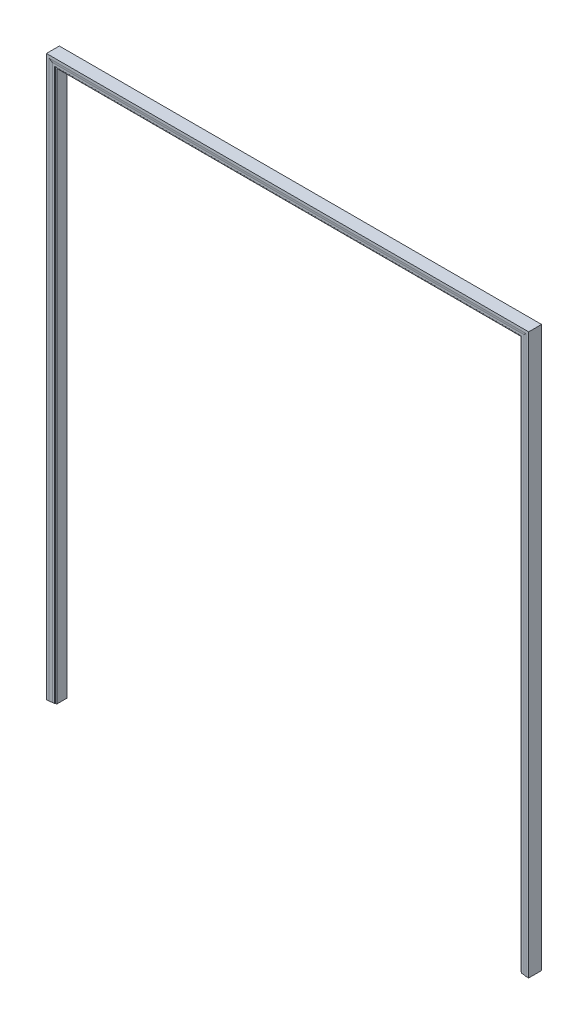
from build123d import *

# Parameters (mm, degrees)
SKETCH1_W           = 1870
SKETCH1_H           = 2205
SKETCH1_W_2         = 1800
SKETCH1_H_2         = 2135
BOSS_EXTRUDE1_DEPTH = 25
SKETCH2_W           = 1810
SKETCH2_H           = 2145
CUT_EXTRUDE2_DEPTH  = 5
SKETCH3_W           = 1825
SKETCH3_H           = 2160
CUT_EXTRUDE4_DEPTH  = 2
FILLET1_R           = 1
CHAMFER1_SIZE       = 2.33256371
CHAMFER1_SIZE_2     = 12
FILLET2_R           = 1
CHAMFER2_SIZE       = 2.33256371
CHAMFER2_SIZE_2     = 12
SKETCH5_W           = 1870
SKETCH5_H           = 50
CUT_EXTRUDE5_DEPTH  = 35


with BuildPart() as part:
    # Sketch1 → Boss-Extrude1 (new, symmetric)
    with BuildSketch(Plane.XY):
        Rectangle(SKETCH1_W, SKETCH1_H)
        Rectangle(SKETCH1_W_2, SKETCH1_H_2, mode=Mode.SUBTRACT)
    extrude(amount=BOSS_EXTRUDE1_DEPTH, both=True)

    # Sketch2 → Cut-Extrude2 (cut)
    with BuildSketch(Plane.XY.offset(25)):
        Rectangle(SKETCH2_W, SKETCH2_H)
    cut_extrude2 = extrude(amount=-CUT_EXTRUDE2_DEPTH, mode=Mode.SUBTRACT)

    # Sketch3 → Cut-Extrude4 (cut)
    with BuildSketch(Plane.XY.offset(25)):
        Rectangle(SKETCH3_W, SKETCH3_H)
    cut_extrude4 = extrude(amount=-CUT_EXTRUDE4_DEPTH, mode=Mode.SUBTRACT)

    # Fillet1
    fillet1_edges = [part.edges().sort_by_distance(p)[0] for p in [
        (0, -1072.5, 23),
        (-905, 0, 23),
        (0, 1072.5, 23),
        (905, 0, 23),
    ]]
    fillet(fillet1_edges, radius=FILLET1_R)

    # Chamfer1
    # the kernel refuses this chamfer: 12, 2.33256371 mm, written as the material it takes off along each edge
    with BuildSketch(Plane(origin=(912.5, 1080, 25), x_dir=(0, -0.1907987049962236, -0.9816291836389973), z_dir=(-1, 0, 0))) as chamfer1_piece_1_section:
        Polygon((CHAMFER1_SIZE * 0.981629183493, -CHAMFER1_SIZE * 0.190798704968), (-CHAMFER1_SIZE_2 * 0.190798704996, -CHAMFER1_SIZE_2 * 0.981629183639), (0, 0), align=None)
    chamfer1_piece_1 = extrude(amount=1825, mode=Mode.PRIVATE)
    chamfer1_piece_1 = split(chamfer1_piece_1, bisect_by=Plane(origin=(0, 1084.39239505, 23), z_dir=(0, 0, 1)), keep=Keep.TOP, mode=Mode.PRIVATE)
    add(chamfer1_piece_1, mode=Mode.SUBTRACT)
    with BuildSketch(Plane(origin=(912.5, -1080, 25), x_dir=(-0.1907987049962236, 0, -0.9816291836389973), z_dir=(0, 1, 0))) as chamfer1_piece_2_section:
        Polygon((CHAMFER1_SIZE * 0.981629183493, -CHAMFER1_SIZE * 0.190798704968), (-CHAMFER1_SIZE_2 * 0.190798704996, -CHAMFER1_SIZE_2 * 0.981629183639), (0, 0), align=None)
    chamfer1_piece_2 = extrude(amount=2160, mode=Mode.PRIVATE)
    chamfer1_piece_2 = split(chamfer1_piece_2, bisect_by=Plane(origin=(916.89239505, 0, 23), z_dir=(0, 0, 1)), keep=Keep.TOP, mode=Mode.PRIVATE)
    add(chamfer1_piece_2, mode=Mode.SUBTRACT)
    with BuildSketch(Plane(origin=(-912.5, -1080, 25), x_dir=(0, 0.1907987049962236, -0.9816291836389973), z_dir=(1, 0, 0))) as chamfer1_piece_3_section:
        Polygon((CHAMFER1_SIZE * 0.981629183493, -CHAMFER1_SIZE * 0.190798704968), (-CHAMFER1_SIZE_2 * 0.190798704996, -CHAMFER1_SIZE_2 * 0.981629183639), (0, 0), align=None)
    chamfer1_piece_3 = extrude(amount=1825, mode=Mode.PRIVATE)
    chamfer1_piece_3 = split(chamfer1_piece_3, bisect_by=Plane(origin=(0, -1084.39239505, 23), z_dir=(0, 0, 1)), keep=Keep.TOP, mode=Mode.PRIVATE)
    add(chamfer1_piece_3, mode=Mode.SUBTRACT)
    with BuildSketch(Plane(origin=(-912.5, 1080, 25), x_dir=(0.1907987049962236, 0, -0.9816291836389973), z_dir=(0, -1, 0))) as chamfer1_piece_4_section:
        Polygon((CHAMFER1_SIZE * 0.981629183493, -CHAMFER1_SIZE * 0.190798704968), (-CHAMFER1_SIZE_2 * 0.190798704996, -CHAMFER1_SIZE_2 * 0.981629183639), (0, 0), align=None)
    chamfer1_piece_4 = extrude(amount=2160, mode=Mode.PRIVATE)
    chamfer1_piece_4 = split(chamfer1_piece_4, bisect_by=Plane(origin=(-916.89239505, 0, 23), z_dir=(0, 0, 1)), keep=Keep.TOP, mode=Mode.PRIVATE)
    add(chamfer1_piece_4, mode=Mode.SUBTRACT)
    with BuildSketch(Plane(origin=(912.5, -1080, 25), x_dir=(-0.1907987049962236, 0, -0.9816291836389973), z_dir=(0, 1, 0))) as chamfer1_piece_5a_section:
        Polygon((CHAMFER1_SIZE * 0.981629183493, -CHAMFER1_SIZE * 0.190798704968), (-CHAMFER1_SIZE_2 * 0.190798704996, -CHAMFER1_SIZE_2 * 0.981629183639), (0, 0), align=None)
    chamfer1_piece_5a = extrude(amount=2191.178793389, mode=Mode.PRIVATE)
    chamfer1_piece_5a = split(chamfer1_piece_5a, bisect_by=Plane(origin=(916.89239505, 1095.589396695, 23), z_dir=(0, 0, 1)), keep=Keep.TOP, mode=Mode.PRIVATE)
    chamfer1_piece_5a = split(chamfer1_piece_5a, bisect_by=Plane(origin=(916.89239505, 1080, 24.399204817), z_dir=(0, 1, 0)), keep=Keep.TOP, mode=Mode.PRIVATE)
    with BuildSketch(Plane(origin=(943.678793389, 1080, 25), x_dir=(0, -0.1907987049962236, -0.9816291836389973), z_dir=(-1, 0, 0))) as chamfer1_piece_5b_section:
        Polygon((CHAMFER1_SIZE * 0.981629183493, -CHAMFER1_SIZE * 0.190798704968), (-CHAMFER1_SIZE_2 * 0.190798704996, -CHAMFER1_SIZE_2 * 0.981629183639), (0, 0), align=None)
    chamfer1_piece_5b = extrude(amount=1856.178793389, mode=Mode.PRIVATE)
    chamfer1_piece_5b = split(chamfer1_piece_5b, bisect_by=Plane(origin=(928.089396695, 1084.39239505, 23), z_dir=(0, 0, 1)), keep=Keep.TOP, mode=Mode.PRIVATE)
    chamfer1_piece_5b = split(chamfer1_piece_5b, bisect_by=Plane(origin=(912.5, 1084.39239505, 24.399204817), z_dir=(1, 0, 0)), keep=Keep.TOP, mode=Mode.PRIVATE)
    chamfer1_piece_5 = chamfer1_piece_5a & chamfer1_piece_5b
    add(chamfer1_piece_5, mode=Mode.SUBTRACT)
    with BuildSketch(Plane(origin=(912.5, 1080, 25), x_dir=(0, -0.1907987049962236, -0.9816291836389973), z_dir=(-1, 0, 0))) as chamfer1_piece_6a_section:
        Polygon((CHAMFER1_SIZE * 0.981629183493, -CHAMFER1_SIZE * 0.190798704968), (-CHAMFER1_SIZE_2 * 0.190798704996, -CHAMFER1_SIZE_2 * 0.981629183639), (0, 0), align=None)
    chamfer1_piece_6a = extrude(amount=1856.178793389, mode=Mode.PRIVATE)
    chamfer1_piece_6a = split(chamfer1_piece_6a, bisect_by=Plane(origin=(-928.089396695, 1084.39239505, 23), z_dir=(0, 0, 1)), keep=Keep.TOP, mode=Mode.PRIVATE)
    chamfer1_piece_6a = split(chamfer1_piece_6a, bisect_by=Plane(origin=(-912.5, 1084.39239505, 24.399204817), z_dir=(-1, 0, 0)), keep=Keep.TOP, mode=Mode.PRIVATE)
    with BuildSketch(Plane(origin=(-912.5, 1111.178793389, 25), x_dir=(0.1907987049962236, 0, -0.9816291836389973), z_dir=(0, -1, 0))) as chamfer1_piece_6b_section:
        Polygon((CHAMFER1_SIZE * 0.981629183493, -CHAMFER1_SIZE * 0.190798704968), (-CHAMFER1_SIZE_2 * 0.190798704996, -CHAMFER1_SIZE_2 * 0.981629183639), (0, 0), align=None)
    chamfer1_piece_6b = extrude(amount=2191.178793389, mode=Mode.PRIVATE)
    chamfer1_piece_6b = split(chamfer1_piece_6b, bisect_by=Plane(origin=(-916.89239505, 1095.589396695, 23), z_dir=(0, 0, 1)), keep=Keep.TOP, mode=Mode.PRIVATE)
    chamfer1_piece_6b = split(chamfer1_piece_6b, bisect_by=Plane(origin=(-916.89239505, 1080, 24.399204817), z_dir=(0, 1, 0)), keep=Keep.TOP, mode=Mode.PRIVATE)
    chamfer1_piece_6 = chamfer1_piece_6a & chamfer1_piece_6b
    add(chamfer1_piece_6, mode=Mode.SUBTRACT)
    with BuildSketch(Plane(origin=(912.5, -1111.178793389, 25), x_dir=(-0.1907987049962236, 0, -0.9816291836389973), z_dir=(0, 1, 0))) as chamfer1_piece_7a_section:
        Polygon((CHAMFER1_SIZE * 0.981629183493, -CHAMFER1_SIZE * 0.190798704968), (-CHAMFER1_SIZE_2 * 0.190798704996, -CHAMFER1_SIZE_2 * 0.981629183639), (0, 0), align=None)
    chamfer1_piece_7a = extrude(amount=2191.178793389, mode=Mode.PRIVATE)
    chamfer1_piece_7a = split(chamfer1_piece_7a, bisect_by=Plane(origin=(916.89239505, -1095.589396695, 23), z_dir=(0, 0, 1)), keep=Keep.TOP, mode=Mode.PRIVATE)
    chamfer1_piece_7a = split(chamfer1_piece_7a, bisect_by=Plane(origin=(916.89239505, -1080, 24.399204817), z_dir=(0, -1, 0)), keep=Keep.TOP, mode=Mode.PRIVATE)
    with BuildSketch(Plane(origin=(-912.5, -1080, 25), x_dir=(0, 0.1907987049962236, -0.9816291836389973), z_dir=(1, 0, 0))) as chamfer1_piece_7b_section:
        Polygon((CHAMFER1_SIZE * 0.981629183493, -CHAMFER1_SIZE * 0.190798704968), (-CHAMFER1_SIZE_2 * 0.190798704996, -CHAMFER1_SIZE_2 * 0.981629183639), (0, 0), align=None)
    chamfer1_piece_7b = extrude(amount=1856.178793389, mode=Mode.PRIVATE)
    chamfer1_piece_7b = split(chamfer1_piece_7b, bisect_by=Plane(origin=(928.089396695, -1084.39239505, 23), z_dir=(0, 0, 1)), keep=Keep.TOP, mode=Mode.PRIVATE)
    chamfer1_piece_7b = split(chamfer1_piece_7b, bisect_by=Plane(origin=(912.5, -1084.39239505, 24.399204817), z_dir=(1, 0, 0)), keep=Keep.TOP, mode=Mode.PRIVATE)
    chamfer1_piece_7 = chamfer1_piece_7a & chamfer1_piece_7b
    add(chamfer1_piece_7, mode=Mode.SUBTRACT)
    with BuildSketch(Plane(origin=(-943.678793389, -1080, 25), x_dir=(0, 0.1907987049962236, -0.9816291836389973), z_dir=(1, 0, 0))) as chamfer1_piece_8a_section:
        Polygon((CHAMFER1_SIZE * 0.981629183493, -CHAMFER1_SIZE * 0.190798704968), (-CHAMFER1_SIZE_2 * 0.190798704996, -CHAMFER1_SIZE_2 * 0.981629183639), (0, 0), align=None)
    chamfer1_piece_8a = extrude(amount=1856.178793389, mode=Mode.PRIVATE)
    chamfer1_piece_8a = split(chamfer1_piece_8a, bisect_by=Plane(origin=(-928.089396695, -1084.39239505, 23), z_dir=(0, 0, 1)), keep=Keep.TOP, mode=Mode.PRIVATE)
    chamfer1_piece_8a = split(chamfer1_piece_8a, bisect_by=Plane(origin=(-912.5, -1084.39239505, 24.399204817), z_dir=(-1, 0, 0)), keep=Keep.TOP, mode=Mode.PRIVATE)
    with BuildSketch(Plane(origin=(-912.5, 1080, 25), x_dir=(0.1907987049962236, 0, -0.9816291836389973), z_dir=(0, -1, 0))) as chamfer1_piece_8b_section:
        Polygon((CHAMFER1_SIZE * 0.981629183493, -CHAMFER1_SIZE * 0.190798704968), (-CHAMFER1_SIZE_2 * 0.190798704996, -CHAMFER1_SIZE_2 * 0.981629183639), (0, 0), align=None)
    chamfer1_piece_8b = extrude(amount=2191.178793389, mode=Mode.PRIVATE)
    chamfer1_piece_8b = split(chamfer1_piece_8b, bisect_by=Plane(origin=(-916.89239505, -1095.589396695, 23), z_dir=(0, 0, 1)), keep=Keep.TOP, mode=Mode.PRIVATE)
    chamfer1_piece_8b = split(chamfer1_piece_8b, bisect_by=Plane(origin=(-916.89239505, -1080, 24.399204817), z_dir=(0, -1, 0)), keep=Keep.TOP, mode=Mode.PRIVATE)
    chamfer1_piece_8 = chamfer1_piece_8a & chamfer1_piece_8b
    add(chamfer1_piece_8, mode=Mode.SUBTRACT)

    # Mirror1: Cut-Extrude2, Cut-Extrude4 across plane
    add(cut_extrude2.mirror(Plane.XY), mode=Mode.SUBTRACT)
    add(cut_extrude4.mirror(Plane.XY), mode=Mode.SUBTRACT)

    # Fillet2
    fillet2_edges = [part.edges().sort_by_distance(p)[0] for p in [
        (0, 1072.5, -23),
        (0, -1072.5, -23),
        (-905, 0, -23),
        (905, 0, -23),
    ]]
    fillet(fillet2_edges, radius=FILLET2_R)

    # Chamfer2
    # the kernel refuses this chamfer: 12, 2.33256371 mm, written as the material it takes off along each edge
    with BuildSketch(Plane(origin=(912.5, 1080, -25), x_dir=(0, -0.1907987049962236, 0.9816291836389973), z_dir=(-1, 0, 0))) as chamfer2_piece_1_section:
        Polygon((CHAMFER2_SIZE * 0.981629183493, CHAMFER2_SIZE * 0.190798704968), (-CHAMFER2_SIZE_2 * 0.190798704996, CHAMFER2_SIZE_2 * 0.981629183639), (0, 0), align=None)
    chamfer2_piece_1 = extrude(amount=1825, mode=Mode.PRIVATE)
    chamfer2_piece_1 = split(chamfer2_piece_1, bisect_by=Plane(origin=(0, 1084.39239505, -23), z_dir=(0, 0, -1)), keep=Keep.TOP, mode=Mode.PRIVATE)
    add(chamfer2_piece_1, mode=Mode.SUBTRACT)
    with BuildSketch(Plane(origin=(912.5, -1080, -25), x_dir=(-0.1907987049962236, 0, 0.9816291836389973), z_dir=(0, 1, 0))) as chamfer2_piece_2_section:
        Polygon((CHAMFER2_SIZE * 0.981629183493, CHAMFER2_SIZE * 0.190798704968), (-CHAMFER2_SIZE_2 * 0.190798704996, CHAMFER2_SIZE_2 * 0.981629183639), (0, 0), align=None)
    chamfer2_piece_2 = extrude(amount=2160, mode=Mode.PRIVATE)
    chamfer2_piece_2 = split(chamfer2_piece_2, bisect_by=Plane(origin=(916.89239505, 0, -23), z_dir=(0, 0, -1)), keep=Keep.TOP, mode=Mode.PRIVATE)
    add(chamfer2_piece_2, mode=Mode.SUBTRACT)
    with BuildSketch(Plane(origin=(-912.5, 1080, -25), x_dir=(0.1907987049962236, 0, 0.9816291836389973), z_dir=(0, -1, 0))) as chamfer2_piece_3_section:
        Polygon((CHAMFER2_SIZE * 0.981629183493, CHAMFER2_SIZE * 0.190798704968), (-CHAMFER2_SIZE_2 * 0.190798704996, CHAMFER2_SIZE_2 * 0.981629183639), (0, 0), align=None)
    chamfer2_piece_3 = extrude(amount=2160, mode=Mode.PRIVATE)
    chamfer2_piece_3 = split(chamfer2_piece_3, bisect_by=Plane(origin=(-916.89239505, 0, -23), z_dir=(0, 0, -1)), keep=Keep.TOP, mode=Mode.PRIVATE)
    add(chamfer2_piece_3, mode=Mode.SUBTRACT)
    with BuildSketch(Plane(origin=(-912.5, -1080, -25), x_dir=(0, 0.1907987049962236, 0.9816291836389973), z_dir=(1, 0, 0))) as chamfer2_piece_4_section:
        Polygon((CHAMFER2_SIZE * 0.981629183493, CHAMFER2_SIZE * 0.190798704968), (-CHAMFER2_SIZE_2 * 0.190798704996, CHAMFER2_SIZE_2 * 0.981629183639), (0, 0), align=None)
    chamfer2_piece_4 = extrude(amount=1825, mode=Mode.PRIVATE)
    chamfer2_piece_4 = split(chamfer2_piece_4, bisect_by=Plane(origin=(0, -1084.39239505, -23), z_dir=(0, 0, -1)), keep=Keep.TOP, mode=Mode.PRIVATE)
    add(chamfer2_piece_4, mode=Mode.SUBTRACT)
    with BuildSketch(Plane(origin=(912.5, -1080, -25), x_dir=(-0.1907987049962236, 0, 0.9816291836389973), z_dir=(0, 1, 0))) as chamfer2_piece_5a_section:
        Polygon((CHAMFER2_SIZE * 0.981629183493, CHAMFER2_SIZE * 0.190798704968), (-CHAMFER2_SIZE_2 * 0.190798704996, CHAMFER2_SIZE_2 * 0.981629183639), (0, 0), align=None)
    chamfer2_piece_5a = extrude(amount=2191.178793389, mode=Mode.PRIVATE)
    chamfer2_piece_5a = split(chamfer2_piece_5a, bisect_by=Plane(origin=(916.89239505, 1095.589396695, -23), z_dir=(0, 0, -1)), keep=Keep.TOP, mode=Mode.PRIVATE)
    chamfer2_piece_5a = split(chamfer2_piece_5a, bisect_by=Plane(origin=(916.89239505, 1080, -24.399204817), z_dir=(0, 1, 0)), keep=Keep.TOP, mode=Mode.PRIVATE)
    with BuildSketch(Plane(origin=(943.678793389, 1080, -25), x_dir=(0, -0.1907987049962236, 0.9816291836389973), z_dir=(-1, 0, 0))) as chamfer2_piece_5b_section:
        Polygon((CHAMFER2_SIZE * 0.981629183493, CHAMFER2_SIZE * 0.190798704968), (-CHAMFER2_SIZE_2 * 0.190798704996, CHAMFER2_SIZE_2 * 0.981629183639), (0, 0), align=None)
    chamfer2_piece_5b = extrude(amount=1856.178793389, mode=Mode.PRIVATE)
    chamfer2_piece_5b = split(chamfer2_piece_5b, bisect_by=Plane(origin=(928.089396695, 1084.39239505, -23), z_dir=(0, 0, -1)), keep=Keep.TOP, mode=Mode.PRIVATE)
    chamfer2_piece_5b = split(chamfer2_piece_5b, bisect_by=Plane(origin=(912.5, 1084.39239505, -24.399204817), z_dir=(1, 0, 0)), keep=Keep.TOP, mode=Mode.PRIVATE)
    chamfer2_piece_5 = chamfer2_piece_5a & chamfer2_piece_5b
    add(chamfer2_piece_5, mode=Mode.SUBTRACT)
    with BuildSketch(Plane(origin=(912.5, 1080, -25), x_dir=(0, -0.1907987049962236, 0.9816291836389973), z_dir=(-1, 0, 0))) as chamfer2_piece_6a_section:
        Polygon((CHAMFER2_SIZE * 0.981629183493, CHAMFER2_SIZE * 0.190798704968), (-CHAMFER2_SIZE_2 * 0.190798704996, CHAMFER2_SIZE_2 * 0.981629183639), (0, 0), align=None)
    chamfer2_piece_6a = extrude(amount=1856.178793389, mode=Mode.PRIVATE)
    chamfer2_piece_6a = split(chamfer2_piece_6a, bisect_by=Plane(origin=(-928.089396695, 1084.39239505, -23), z_dir=(0, 0, -1)), keep=Keep.TOP, mode=Mode.PRIVATE)
    chamfer2_piece_6a = split(chamfer2_piece_6a, bisect_by=Plane(origin=(-912.5, 1084.39239505, -24.399204817), z_dir=(-1, 0, 0)), keep=Keep.TOP, mode=Mode.PRIVATE)
    with BuildSketch(Plane(origin=(-912.5, 1111.178793389, -25), x_dir=(0.1907987049962236, 0, 0.9816291836389973), z_dir=(0, -1, 0))) as chamfer2_piece_6b_section:
        Polygon((CHAMFER2_SIZE * 0.981629183493, CHAMFER2_SIZE * 0.190798704968), (-CHAMFER2_SIZE_2 * 0.190798704996, CHAMFER2_SIZE_2 * 0.981629183639), (0, 0), align=None)
    chamfer2_piece_6b = extrude(amount=2191.178793389, mode=Mode.PRIVATE)
    chamfer2_piece_6b = split(chamfer2_piece_6b, bisect_by=Plane(origin=(-916.89239505, 1095.589396695, -23), z_dir=(0, 0, -1)), keep=Keep.TOP, mode=Mode.PRIVATE)
    chamfer2_piece_6b = split(chamfer2_piece_6b, bisect_by=Plane(origin=(-916.89239505, 1080, -24.399204817), z_dir=(0, 1, 0)), keep=Keep.TOP, mode=Mode.PRIVATE)
    chamfer2_piece_6 = chamfer2_piece_6a & chamfer2_piece_6b
    add(chamfer2_piece_6, mode=Mode.SUBTRACT)
    with BuildSketch(Plane(origin=(912.5, -1111.178793389, -25), x_dir=(-0.1907987049962236, 0, 0.9816291836389973), z_dir=(0, 1, 0))) as chamfer2_piece_7a_section:
        Polygon((CHAMFER2_SIZE * 0.981629183493, CHAMFER2_SIZE * 0.190798704968), (-CHAMFER2_SIZE_2 * 0.190798704996, CHAMFER2_SIZE_2 * 0.981629183639), (0, 0), align=None)
    chamfer2_piece_7a = extrude(amount=2191.178793389, mode=Mode.PRIVATE)
    chamfer2_piece_7a = split(chamfer2_piece_7a, bisect_by=Plane(origin=(916.89239505, -1095.589396695, -23), z_dir=(0, 0, -1)), keep=Keep.TOP, mode=Mode.PRIVATE)
    chamfer2_piece_7a = split(chamfer2_piece_7a, bisect_by=Plane(origin=(916.89239505, -1080, -24.399204817), z_dir=(0, -1, 0)), keep=Keep.TOP, mode=Mode.PRIVATE)
    with BuildSketch(Plane(origin=(-912.5, -1080, -25), x_dir=(0, 0.1907987049962236, 0.9816291836389973), z_dir=(1, 0, 0))) as chamfer2_piece_7b_section:
        Polygon((CHAMFER2_SIZE * 0.981629183493, CHAMFER2_SIZE * 0.190798704968), (-CHAMFER2_SIZE_2 * 0.190798704996, CHAMFER2_SIZE_2 * 0.981629183639), (0, 0), align=None)
    chamfer2_piece_7b = extrude(amount=1856.178793389, mode=Mode.PRIVATE)
    chamfer2_piece_7b = split(chamfer2_piece_7b, bisect_by=Plane(origin=(928.089396695, -1084.39239505, -23), z_dir=(0, 0, -1)), keep=Keep.TOP, mode=Mode.PRIVATE)
    chamfer2_piece_7b = split(chamfer2_piece_7b, bisect_by=Plane(origin=(912.5, -1084.39239505, -24.399204817), z_dir=(1, 0, 0)), keep=Keep.TOP, mode=Mode.PRIVATE)
    chamfer2_piece_7 = chamfer2_piece_7a & chamfer2_piece_7b
    add(chamfer2_piece_7, mode=Mode.SUBTRACT)
    with BuildSketch(Plane(origin=(-943.678793389, -1080, -25), x_dir=(0, 0.1907987049962236, 0.9816291836389973), z_dir=(1, 0, 0))) as chamfer2_piece_8a_section:
        Polygon((CHAMFER2_SIZE * 0.981629183493, CHAMFER2_SIZE * 0.190798704968), (-CHAMFER2_SIZE_2 * 0.190798704996, CHAMFER2_SIZE_2 * 0.981629183639), (0, 0), align=None)
    chamfer2_piece_8a = extrude(amount=1856.178793389, mode=Mode.PRIVATE)
    chamfer2_piece_8a = split(chamfer2_piece_8a, bisect_by=Plane(origin=(-928.089396695, -1084.39239505, -23), z_dir=(0, 0, -1)), keep=Keep.TOP, mode=Mode.PRIVATE)
    chamfer2_piece_8a = split(chamfer2_piece_8a, bisect_by=Plane(origin=(-912.5, -1084.39239505, -24.399204817), z_dir=(-1, 0, 0)), keep=Keep.TOP, mode=Mode.PRIVATE)
    with BuildSketch(Plane(origin=(-912.5, 1080, -25), x_dir=(0.1907987049962236, 0, 0.9816291836389973), z_dir=(0, -1, 0))) as chamfer2_piece_8b_section:
        Polygon((CHAMFER2_SIZE * 0.981629183493, CHAMFER2_SIZE * 0.190798704968), (-CHAMFER2_SIZE_2 * 0.190798704996, CHAMFER2_SIZE_2 * 0.981629183639), (0, 0), align=None)
    chamfer2_piece_8b = extrude(amount=2191.178793389, mode=Mode.PRIVATE)
    chamfer2_piece_8b = split(chamfer2_piece_8b, bisect_by=Plane(origin=(-916.89239505, -1095.589396695, -23), z_dir=(0, 0, -1)), keep=Keep.TOP, mode=Mode.PRIVATE)
    chamfer2_piece_8b = split(chamfer2_piece_8b, bisect_by=Plane(origin=(-916.89239505, -1080, -24.399204817), z_dir=(0, -1, 0)), keep=Keep.TOP, mode=Mode.PRIVATE)
    chamfer2_piece_8 = chamfer2_piece_8a & chamfer2_piece_8b
    add(chamfer2_piece_8, mode=Mode.SUBTRACT)

    # Sketch5 → Cut-Extrude5 (cut)
    with BuildSketch(Plane.XZ.offset(1102.5)):
        Rectangle(SKETCH5_W, SKETCH5_H)
    extrude(amount=-CUT_EXTRUDE5_DEPTH, mode=Mode.SUBTRACT)


solid = part.part
